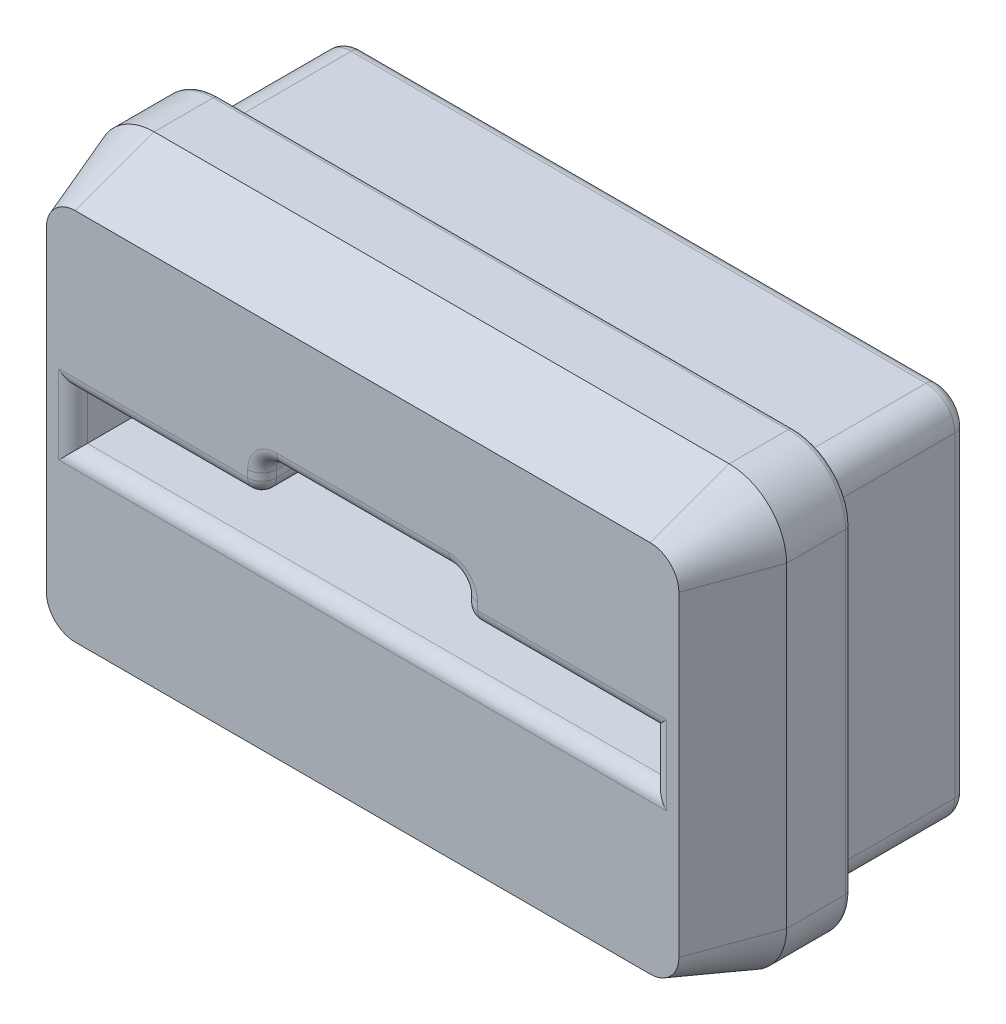
from build123d import *

# Parameters (mm, degrees)
SKETCH1_W           = 24
SKETCH1_H           = 13
BOSS_EXTRUDE1_DEPTH = 15
SKETCH2_W           = 20.15
SKETCH2_H           = 1.75
CUT_EXTRUDE1_DEPTH  = 15
FILLET1_R           = 2
CHAMFER2_SIZE       = 1
CHAMFER2_SIZE2      = 2.747477419
FILLET2_R           = 0.5
CUT_EXTRUDE4_DEPTH  = 11
SKETCH5_W           = 26.855674208
SKETCH5_H           = 19.307728506
CUT_EXTRUDE5_DEPTH  = 8
CUT_EXTRUDE6_DEPTH  = 11
SKETCH7_W           = 29.982721697
SKETCH7_H           = 21.559004648
CUT_EXTRUDE7_DEPTH  = 3
CHAMFER3_SIZE       = 2
FILLET3_R           = 0.4
FILLET4_R           = 0.2
SKETCH8_W           = 7
SKETCH8_H           = 2.5
CUT_EXTRUDE8_DEPTH  = 21.808652047
FILLET5_R           = 0.5


with BuildPart() as part:
    # Sketch1 → Boss-Extrude1 (new body)
    with BuildSketch(Plane(origin=(0, 0, 0), x_dir=(1, 0, 0), z_dir=(0, 1, 0))):
        Rectangle(SKETCH1_W, SKETCH1_H)
    extrude(amount=BOSS_EXTRUDE1_DEPTH)

    # Sketch2 → Cut-Extrude1 (cut)
    with BuildSketch(Plane.XY.offset(6.5)):
        with Locations((0, 7.575)):
            Rectangle(SKETCH2_W, SKETCH2_H)
    extrude(amount=-CUT_EXTRUDE1_DEPTH, mode=Mode.SUBTRACT)

    # Fillet1
    fillet1_edges = [part.edges().sort_by_distance(p)[0] for p in [
        (12, 15, 0),
        (12, 0, 0),
        (-12, 0, 0),
        (-12, 15, 0),
    ]]
    fillet(fillet1_edges, radius=FILLET1_R)

    # Chamfer2
    chamfer2_edges = [part.edges().sort_by_distance(p)[0] for p in [
        (0, 0, 6.5),
        (-11.414213562, 0.585786438, 6.5),
        (11.414213562, 0.585786438, 6.5),
        (-12, 7.5, 6.5),
        (12, 7.5, 6.5),
        (-11.414213562, 14.414213562, 6.5),
        (11.414213562, 14.414213562, 6.5),
        (0, 15, 6.5),
    ]]
    chamfer2_side = [part.faces().sort_by_distance(p)[0] for p in [
        (11.716980566, 7.5, 6.5),
    ]]
    chamfer(chamfer2_edges, length=CHAMFER2_SIZE, length2=CHAMFER2_SIZE2, reference=chamfer2_side[0])

    # Fillet2
    fillet2_edges = [part.edges().sort_by_distance(p)[0] for p in [
        (10.075, 7.575, 6.5),
        (0, 8.45, 6.5),
        (-10.075, 7.575, 6.5),
        (0, 6.7, 6.5),
    ]]
    fillet(fillet2_edges, radius=FILLET2_R)

    # Sketch4 → Cut-Extrude4 (cut)
    with BuildSketch(Plane(origin=(0, 0, -6.5), x_dir=(-1, 0, 0), z_dir=(0, 0, -1))):
        Polygon((-10.075, 8.45), (-8.575, 8.45), (-8.575, 11.891155889), (8.575, 11.891155889), (8.575, 8.45), (10.075, 8.45), (10.075, 6.7), (-10.075, 6.7), align=None)
    extrude(amount=-CUT_EXTRUDE4_DEPTH, mode=Mode.SUBTRACT)

    # Sketch5 → Cut-Extrude5 (cut)
    with BuildSketch(Plane(origin=(0, 0, -6.5), x_dir=(-1, 0, 0), z_dir=(0, 0, -1))):
        with Locations((-0.083402715, 7.762018115)):
            Rectangle(SKETCH5_W, SKETCH5_H)
        with BuildLine():
            Line((10, 14), (-10, 14))
            ThreePointArc((-10, 14), (-10.707106781, 13.707106781), (-11, 13))
            Line((-11, 13), (-11, 2))
            ThreePointArc((-11, 2), (-10.707106781, 1.292893219), (-10, 1))
            Line((-10, 1), (10, 1))
            ThreePointArc((10, 1), (10.707106781, 1.292893219), (11, 2))
            Line((11, 2), (11, 13))
            ThreePointArc((11, 13), (10.707106781, 13.707106781), (10, 14))
        make_face(mode=Mode.SUBTRACT)
    extrude(amount=-CUT_EXTRUDE5_DEPTH, mode=Mode.SUBTRACT)

    # Sketch6 → Cut-Extrude6 (cut)
    with BuildSketch(Plane(origin=(0, 0, -6.5), x_dir=(-1, 0, 0), z_dir=(0, 0, -1))):
        with BuildLine():
            Line((-9, 5.7), (9, 5.7))
            ThreePointArc((9, 5.7), (9.707106781, 5.407106781), (10, 4.7))
            Line((10, 4.7), (10, 3))
            ThreePointArc((10, 3), (9.707106781, 2.292893219), (9, 2))
            Line((9, 2), (-9, 2))
            ThreePointArc((-9, 2), (-9.707106781, 2.292893219), (-10, 3))
            Line((-10, 3), (-10, 4.7))
            ThreePointArc((-10, 4.7), (-9.707106781, 5.407106781), (-9, 5.7))
        make_face()
    extrude(amount=-CUT_EXTRUDE6_DEPTH, mode=Mode.SUBTRACT)

    # Sketch7 → Cut-Extrude7 (cut)
    with BuildSketch(Plane(origin=(0, 0, -6.5), x_dir=(-1, 0, 0), z_dir=(0, 0, -1))):
        with Locations((0.615824589, 7.279559508)):
            Rectangle(SKETCH7_W, SKETCH7_H)
    extrude(amount=-CUT_EXTRUDE7_DEPTH, mode=Mode.SUBTRACT)

    # Chamfer3
    chamfer3_edges = [part.edges().sort_by_distance(p)[0] for p in [
        (9.325, 8.45, -3.5),
        (-9.325, 8.45, -3.5),
    ]]
    chamfer(chamfer3_edges, length=CHAMFER3_SIZE)

    # Fillet3
    fillet3_edges = [part.edges().sort_by_distance(p)[0] for p in [
        (-9.707106781, 5.407106781, -3.5),
        (0, 5.7, -3.5),
        (9.707106781, 5.407106781, -3.5),
        (10, 3.85, -3.5),
        (9.707106781, 2.292893219, -3.5),
        (0, 2, -3.5),
        (-9.707106781, 2.292893219, -3.5),
        (10.707106781, 13.707106781, -3.5),
        (11, 7.5, -3.5),
        (10.707106781, 1.292893219, -3.5),
        (0, 1, -3.5),
        (-10.707106781, 1.292893219, -3.5),
        (-11, 7.5, -3.5),
        (-10.707106781, 13.707106781, -3.5),
        (9.325, 10.45, -3.5),
        (8.575, 11.170577944, -3.5),
        (-9.325, 10.45, -3.5),
        (-8.575, 11.170577944, -3.5),
        (0, 11.891155889, -3.5),
        (0, 6.7, -3.5),
        (-10, 3.85, -3.5),
        (0, 14, -3.5),
    ]]
    fillet(fillet3_edges, radius=FILLET3_R)

    # Fillet4
    fillet4_edges = [part.edges().sort_by_distance(p)[0] for p in [
        (0, 15, 1.5),
        (11.414213562, 14.414213562, 1.5),
        (12, 7.5, 1.5),
        (11.414213562, 0.585786438, 1.5),
        (0, 0, 1.5),
        (-11.414213562, 0.585786438, 1.5),
        (-12, 7.5, 1.5),
        (-11.414213562, 14.414213562, 1.5),
    ]]
    fillet(fillet4_edges, radius=FILLET4_R)

    # Sketch8 → Cut-Extrude8 (cut, through all)
    with BuildSketch(Plane(origin=(0, 0, 4.5), x_dir=(-1, 0, 0), z_dir=(0, 0, -1))):
        with Locations((0, 8.45)):
            Rectangle(SKETCH8_W, SKETCH8_H)
    extrude(amount=-CUT_EXTRUDE8_DEPTH, mode=Mode.SUBTRACT)

    # Fillet5
    fillet5_edges = [part.edges().sort_by_distance(p)[0] for p in [
        (3.5, 8.45, 5.25),
        (3.5, 8.596446609, 6.353553391),
        (3.5, 9.325, 6.5),
        (0, 9.7, 6.5),
        (-3.5, 9.325, 6.5),
        (-3.5, 8.45, 5.25),
        (-3.5, 8.596446609, 6.353553391),
        (-3.5, 9.7, 5.5),
        (3.5, 9.7, 5.5),
    ]]
    fillet(fillet5_edges, radius=FILLET5_R)


solid = part.part
